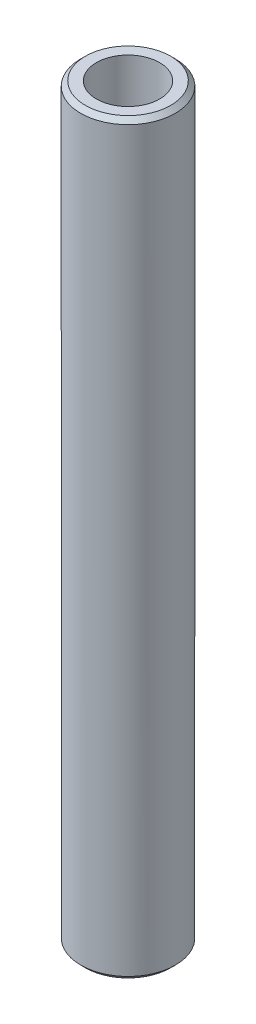
from build123d import *

# Parameters (mm, degrees)
SKETCH1_R           = 35
BOSS_EXTRUDE1_DEPTH = 553.237199263
SKETCH2_R           = 23.402436083
CUT_EXTRUDE1_DEPTH  = 556.44702596
CHAMFER1_SIZE       = 3.404476568


with BuildPart() as part:
    # Sketch1 → Boss-Extrude1 (new body)
    with BuildSketch(Plane(origin=(0, 0, 0), x_dir=(1, 0, 0), z_dir=(0, 1, 0))):
        Circle(SKETCH1_R)
    extrude(amount=BOSS_EXTRUDE1_DEPTH)

    # Sketch2 → Cut-Extrude1 (cut, through all)
    with BuildSketch(Plane(origin=(0, 0, 0), x_dir=(1, 0, 0), z_dir=(0, 1, 0))):
        Circle(SKETCH2_R)
    extrude(amount=CUT_EXTRUDE1_DEPTH, mode=Mode.SUBTRACT)

    # Chamfer1
    chamfer1_edges = [part.edges().sort_by_distance(p)[0] for p in [
        (-35, 553.237199263, 0),
        (-35, 0, 0),
    ]]
    chamfer(chamfer1_edges, length=CHAMFER1_SIZE)


solid = part.part
